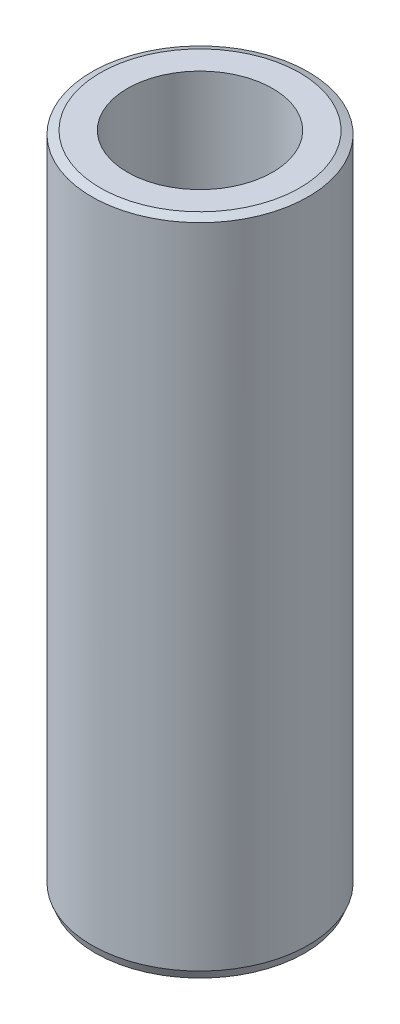
from build123d import *
from OCP.BRepFilletAPI import BRepFilletAPI_MakeChamfer

# Parameters (mm, degrees)
SKETCH1_R           = 60
BOSS_EXTRUDE1_DEPTH = 365.912224411
SKETCH2_R           = 40.262143149
CUT_EXTRUDE1_DEPTH  = 376.621825741
CHAMFER1_SIZE       = 1.901685443
CHAMFER1_SIZE2      = 4.704512275


with BuildPart() as part:
    # Sketch1 → Boss-Extrude1 (new body)
    with BuildSketch(Plane(origin=(0, 0, 0), x_dir=(1, 0, 0), z_dir=(0, 1, 0))):
        Circle(SKETCH1_R)
    extrude(amount=BOSS_EXTRUDE1_DEPTH)

    # Sketch2 → Cut-Extrude1 (cut, through all)
    with BuildSketch(Plane(origin=(0, 0, 0), x_dir=(1, 0, 0), z_dir=(0, 1, 0))):
        Circle(SKETCH2_R)
    extrude(amount=CUT_EXTRUDE1_DEPTH, mode=Mode.SUBTRACT)

    # Chamfer1: one chamfer whose edges measure the first distance from different faces: ONE call of the kernel's chamfer builder (chamfer() names one face for all edges)
    chamfer1_edges_1 = [part.edges().sort_by_distance(p)[0] for p in [
        (-60, 365.912224411, 0),
    ]]
    chamfer1_side_1 = [part.faces().sort_by_distance(p)[0] for p in [
        (-60, 182.956112205, 0),
    ]]
    chamfer1_edges_2 = [part.edges().sort_by_distance(p)[0] for p in [
        (-60, 0, 0),
    ]]
    chamfer1_side_2 = [part.faces().sort_by_distance(p)[0] for p in [
        (-58.302943725, 0, 0),
    ]]
    chamfer1 = BRepFilletAPI_MakeChamfer(part.part.solid().wrapped)
    for e in chamfer1_edges_1:
        chamfer1.Add(CHAMFER1_SIZE, CHAMFER1_SIZE2, e.wrapped, chamfer1_side_1[0].wrapped)  # the first distance lies on this face
    for e in chamfer1_edges_2:
        chamfer1.Add(CHAMFER1_SIZE, CHAMFER1_SIZE2, e.wrapped, chamfer1_side_2[0].wrapped)  # the first distance lies on this face
    add(Compound.cast(chamfer1.Shape()), mode=Mode.REPLACE)


solid = part.part
